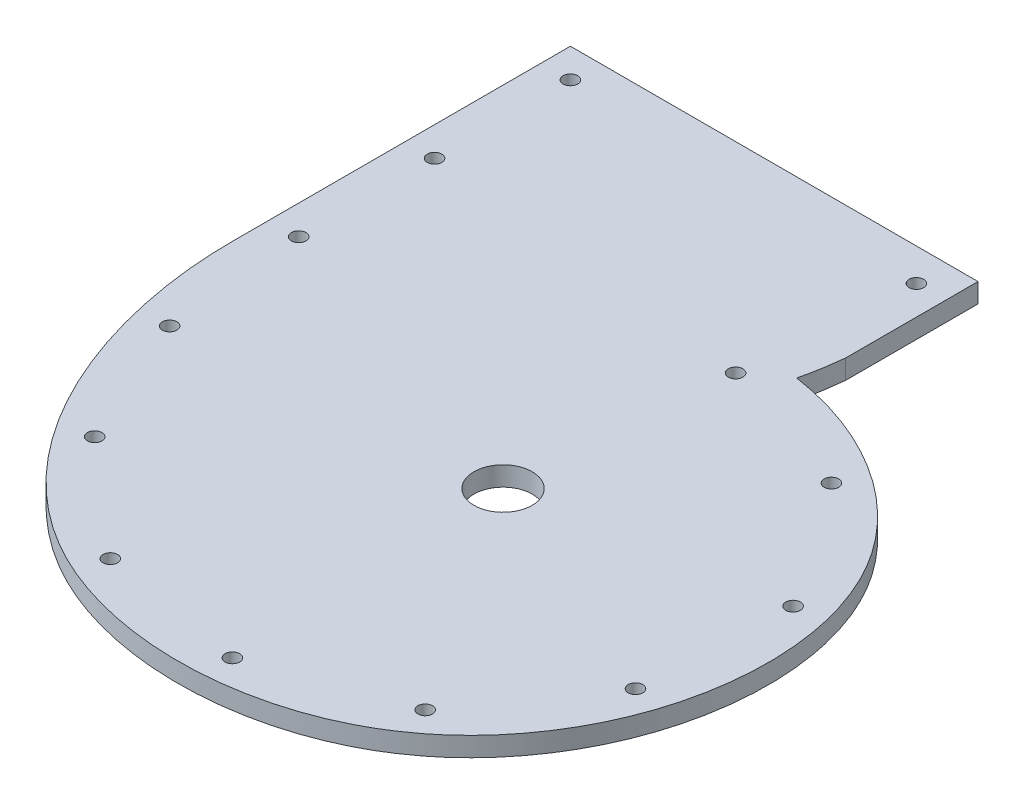
from build123d import *

# Parameters (mm, degrees)
BOSS_EXTRUDE1_DEPTH   = 6.35
FILLET1_R             = 2.54
FILLET2_R             = 0.79375
SKETCH4_R             = 2.38125
CUT_EXTRUDE3_DEPTH    = 6.35
CRVPATTERN1_OUTLINE_R = 2.38125
CRVPATTERN1_DEPTH     = 6.35
SKETCH5_R             = 9.525
BOSS_EXTRUDE2_DEPTH   = 6.35


# Read off the part's stored shape, not the designer's step: CrvPattern1
with BuildPart() as part:
    # Sketch1 → Boss-Extrude1 (new body)
    with BuildSketch(Plane(origin=(0, 0, 0), x_dir=(1, 0, 0), z_dir=(0, 1, 0))):
        with BuildLine():
            Line((0, 136.334024978), (0, 94.083801247))
            add(Edge.make_bspline(
                [(0, 94.083801247), (-2.431386336, 71.693275709), (-15.75825593, 58.230430146)],
                knots=[0, 0, 0, 1, 1, 1], degree=2))
            add(Edge.make_bspline(
                [(-15.75825593, 58.230430146), (12.928997408, 67.764135595), (70.60122301, 46.247103047), (77.540383798, -26.213493844), (40.518788725, -85.775261158), (-67.055108572, -88.304279922), (-95.415707681, -10.214485927), (-95.25, 26.030170649)],
                knots=[0, 0, 0, 0, 0.227546357, 0.356849793, 0.49581236, 0.710996888, 1, 1, 1, 1], degree=3))
            Line((-95.25, 26.030170649), (-95.25, 136.334024978))
            Line((-95.25, 136.334024978), (-114.3, 136.334024978))
            Line((-114.3, 136.334024978), (-114.3, 26.072111228))
            add(Edge.make_bspline(
                [(16.715986391, 79.348568009), (21.633097871, 78.62719896), (31.371857261, 76.389721894), (45.249200497, 70.845276961), (58.14270202, 63.202354702), (69.694268499, 53.486594004), (77.831645881, 43.678743898), (83.1663553, 34.778326042), (87.500656656, 25.500338712), (91.157064432, 13.400044888), (92.998924079, -1.463666218), (92.533158628, -16.332160856), (89.911348046, -30.922868008), (85.224669703, -44.926534482), (78.5424766, -58.087321563), (69.892966554, -70.128088223), (59.334225085, -80.722518946), (46.808294676, -89.48437896), (33.165750854, -95.831204537), (18.8220758, -100.00043745), (4.083822861, -102.101602424), (-10.777441223, -102.219799961), (-25.504851136, -100.381408636), (-37.452741503, -97.197322494), (-46.66563909, -93.622653994), (-53.378233983, -90.404269128), (-59.778019163, -86.667831837), (-67.772964247, -81.11349497), (-76.794838317, -73.191996697), (-86.082507199, -62.480245978), (-96.526865188, -46.978935087), (-104.24741081, -30.151640125), (-109.53383183, -12.800694626), (-112.324631517, 0.306051107), (-113.698273493, 11.158780223), (-114.231429958, 19.740893087), (-114.308990648, 23.9549561), (-114.3, 26.072111228)],
                knots=[0.074418032, 0.074418032, 0.074418032, 0.074418032, 0.103339233, 0.132260434, 0.161181635, 0.190102836, 0.219024037, 0.233484638, 0.247945239, 0.27686644, 0.305787641, 0.334708842, 0.363630043, 0.392551244, 0.421472445, 0.450393647, 0.479314848, 0.508236049, 0.53715725, 0.566078451, 0.594999652, 0.623920853, 0.652842055, 0.681763256, 0.696223856, 0.710684457, 0.725145057, 0.739605658, 0.768526859, 0.79744806, 0.826369261, 0.884211664, 0.913132865, 0.942054066, 0.970975267, 0.985435868, 0.999896468, 0.999896468, 0.999896468, 0.999896468], degree=3))
            add(Edge.make_bspline(
                [(19.05, 93.052513121), (19.023571763, 92.809136693), (18.983692868, 92.443089224), (18.931467162, 91.958957236), (18.862360798, 91.337915751), (18.776292871, 90.610780885), (18.625902721, 89.42512839), (18.420122868, 87.959858448), (18.049990563, 85.627575808), (17.510143571, 82.743597147), (16.996105499, 80.478464636), (16.715986391, 79.348568009)],
                knots=[-0.022894974, -0.022894974, -0.022894974, -0.022894974, -0.006590549, 0.001561663, 0.009713876, 0.0260183, 0.042322725, 0.074931575, 0.107540425, 0.172758125, 0.237975825, 0.237975825, 0.237975825, 0.237975825], degree=3))
            Line((19.05, 93.052513121), (19.05, 136.334024978))
            Line((19.05, 136.334024978), (0, 136.334024978))
        make_face()
    extrude(amount=BOSS_EXTRUDE1_DEPTH)

    # Fillet1
    fillet1_edges = [part.edges().sort_by_distance(p)[0] for p in [
        (0, 3.175, -94.083801247),
        (-95.25, 3.175, -26.030170649),
    ]]
    fillet(fillet1_edges, radius=FILLET1_R)

    # Fillet2
    fillet2_edges = [part.edges().sort_by_distance(p)[0] for p in [
        (-15.75825593, 3.175, -58.230430146),
    ]]
    fillet(fillet2_edges, radius=FILLET2_R)

    # Sketch4 → Cut-Extrude3 (cut)
    with BuildSketch(Plane(origin=(0, 6.35, 0), x_dir=(1, 0, 0), z_dir=(0, 1, 0))):
        with Locations(Location((-104.775, 126.809024978, 0), (0, 0, 270))):
            Circle(SKETCH4_R)
    extrude(amount=-CUT_EXTRUDE3_DEPTH, mode=Mode.SUBTRACT)

    # CrvPattern1 outline → CrvPattern1 (cut)
    with BuildSketch(Plane(origin=(0, 0, 0), x_dir=(1, 0, 0), z_dir=(0, 1, 0))):
        with Locations((-104.775, 82.359024978)):
            Circle(CRVPATTERN1_OUTLINE_R)
        with Locations((-104.775, 37.909024978)):
            Circle(CRVPATTERN1_OUTLINE_R)
        with Locations((-100.597903535, -8.486356178)):
            Circle(CRVPATTERN1_OUTLINE_R)
        with Locations((-81.474554, -52.141471765)):
            Circle(CRVPATTERN1_OUTLINE_R)
        with Locations((-44.376132313, -84.112983027)):
            Circle(CRVPATTERN1_OUTLINE_R)
        with Locations((3.698987105, -92.246074321)):
            Circle(CRVPATTERN1_OUTLINE_R)
        with Locations((49.97064989, -75.450636534)):
            Circle(CRVPATTERN1_OUTLINE_R)
        with Locations((78.388040736, -35.058632959)):
            Circle(CRVPATTERN1_OUTLINE_R)
        with Locations((80.782414242, 14.106535639)):
            Circle(CRVPATTERN1_OUTLINE_R)
        with Locations((52.182738061, 55.247486043)):
            Circle(CRVPATTERN1_OUTLINE_R)
        with Locations((5.302146984, 70.7696737)):
            Circle(CRVPATTERN1_OUTLINE_R)
        with Locations((9.525, 125.703541591)):
            Circle(CRVPATTERN1_OUTLINE_R)
    extrude(amount=CRVPATTERN1_DEPTH, mode=Mode.SUBTRACT)

    # Sketch5 → Boss-Extrude2 (add)
    with BuildSketch(Plane(origin=(0, 6.35, 0), x_dir=(1, 0, 0), z_dir=(0, 1, 0))):
        with BuildLine():
            Line((0, 94.222341016), (0, 136.334024978))
            Line((0, 136.334024978), (-95.25, 136.334024978))
            Line((-95.25, 136.334024978), (-95.25, 26.035946481))
            Line((-95.25, 26.035946481), (-95.250025994, 26.02445519))
            add(Edge.make_bspline(
                [(-95.250025994, 26.02445519), (-95.413998653, -10.219191455), (-67.052567731, -88.304220188), (40.518788725, -85.775261158), (77.540383798, -26.213493844), (70.704250586, 45.171261183), (15.28602209, 66.863348491), (-12.949636793, 59.083069401)],
                knots=[1.5191e-05, 1.5191e-05, 1.5191e-05, 1.5191e-05, 0.289003112, 0.50418764, 0.643150207, 0.772453643, 0.992638541, 0.992638541, 0.992638541, 0.992638541], degree=3))
            ThreePointArc((-12.949636793, 59.083069401), (-13.833627454, 59.427668219), (-13.755858665, 60.373257902))
            add(Edge.make_bspline(
                [(-13.755858665, 60.373257902), (-2.2817326, 73.386271149), (-0.015296893, 93.943999106)],
                knots=[0, 0, 0, 1, 1, 1], degree=2))
            ThreePointArc((-0.015296893, 93.943999106), (-0.003827106, 94.082960051), (0, 94.222341016))
        make_face()
        with Locations(Location((0, 0, 0), (0, 0, 270))):
            Circle(SKETCH5_R, mode=Mode.SUBTRACT)
    extrude(amount=-BOSS_EXTRUDE2_DEPTH)


solid = part.part
